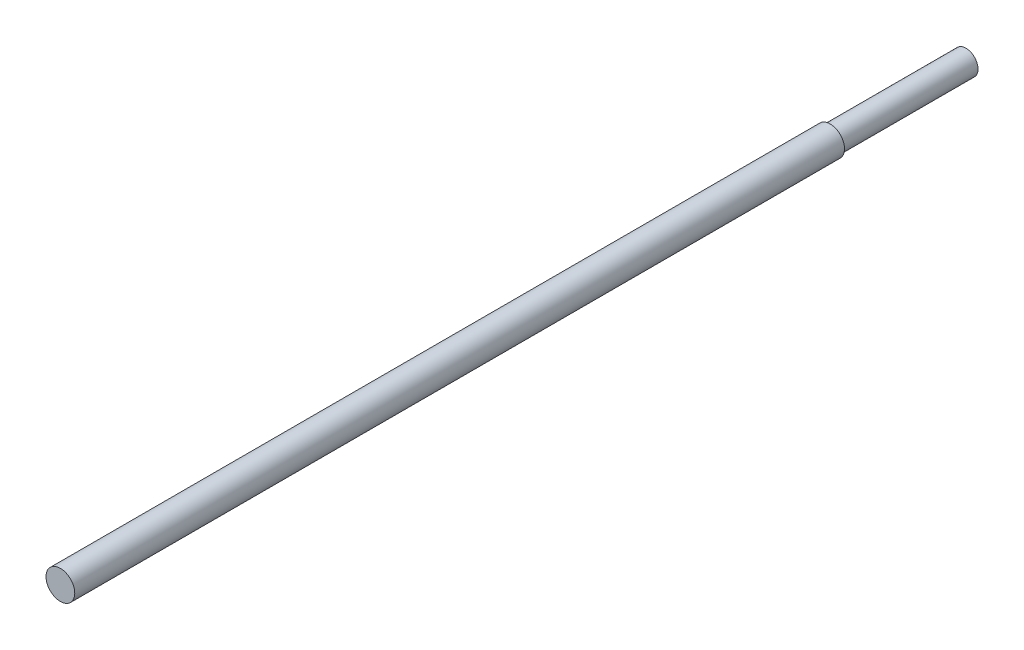
from build123d import *

# Parameters (mm, degrees)
SKETCH1_R           = 4.7625
BOSS_EXTRUDE1_DEPTH = 300
SKETCH3_R           = 4.7625
SKETCH3_R_2         = 4
CUT_EXTRUDE2_DEPTH  = 45


with BuildPart() as part:
    # Sketch1 → Boss-Extrude1 (new body)
    with BuildSketch(Plane.XY):
        Circle(SKETCH1_R)
    extrude(amount=BOSS_EXTRUDE1_DEPTH)

    # Sketch3 → Cut-Extrude2 (cut)
    with BuildSketch(Plane(origin=(0, 0, 0), x_dir=(-1, 0, 0), z_dir=(0, 0, -1))):
        Circle(SKETCH3_R)
        Circle(SKETCH3_R_2, mode=Mode.SUBTRACT)
    extrude(amount=-CUT_EXTRUDE2_DEPTH, mode=Mode.SUBTRACT)


solid = part.part
